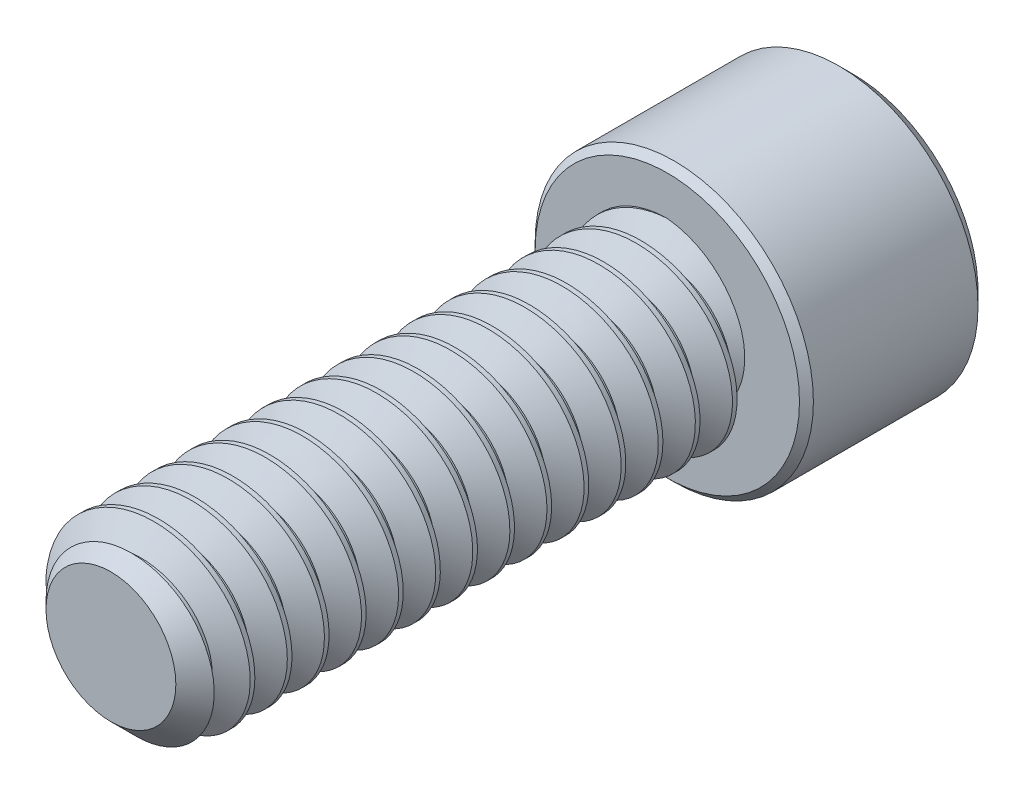
from build123d import *

# Parameters (mm, degrees)
SKETCH1_R          = 3.175
EXTRUDE1_DEPTH     = 19.05
CHAMFER3_SIZE      = 0.9525
CUT_SWEEP1_PITCH   = 1.27
SKETCH6_R          = 4.7625
EXTRUDE2_DEPTH     = 6.35
CUT_EXTRUDE1_DEPTH = 3.571875
CHAMFER1_SIZE      = 0.47625
CHAMFER2_SIZE      = 0.238125


with BuildPart() as part:
    # Sketch1 → Extrude1 (new body)
    with BuildSketch(Plane.XY):
        Circle(SKETCH1_R)
    extrude(amount=-EXTRUDE1_DEPTH)

    # Chamfer3
    chamfer3_edges = [part.edges().sort_by_distance(p)[0] for p in [
        (-3.175, 0, 0),
    ]]
    chamfer(chamfer3_edges, length=CHAMFER3_SIZE)

    # Cut-Sweep1: the profile of Sketch3 profile screwed along a right-hand helix of 16 turns, 6 arcs to a turn; built about Z, then put on its axis
    cut_sweep1_z = Axis((0, 0, 0), (0, 0, 1))
    cut_sweep1_corners = [(3.1753, 0, -1.111423205), (2.350110803, 0, -0.635), (2.350110803, 0, -0.47625), (3.1753, 0, 0.000173205)]
    with BuildLine(mode=Mode.PRIVATE) as cut_sweep1_profile:
        Line(cut_sweep1_corners[0], cut_sweep1_corners[1])
        Line(cut_sweep1_corners[1], cut_sweep1_corners[2])
        Line(cut_sweep1_corners[2], cut_sweep1_corners[3])
        Line(cut_sweep1_corners[3], cut_sweep1_corners[0])
    cut_sweep1_cap = Face(cut_sweep1_profile.wire())
    cut_sweep1_turn_angles = [0, 30, 60, 90, 120, 150, 180, 210, 240, 270, 300, 330, 360]
    cut_sweep1_turn_weights = [1, 0.8660254037844387, 1, 0.8660254037844387, 1, 0.8660254037844387, 1, 0.8660254037844387, 1, 0.8660254037844387, 1, 0.8660254037844387, 1]
    cut_sweep1_turn_rails = [Edge.make_bspline([Vector(p[0], p[1], 0).rotate(cut_sweep1_z, cut_sweep1_turn_angles[k]) / cut_sweep1_turn_weights[k] + Vector(0, 0, p[2] + CUT_SWEEP1_PITCH * cut_sweep1_turn_angles[k] / 360) for k in range(13)], [0, 0, 0, 1, 1, 2, 2, 3, 3, 4, 4, 5, 5, 6, 6, 6], 2, cut_sweep1_turn_weights) for p in cut_sweep1_corners]
    cut_sweep1_turn_sides = [Face.make_surface_from_curves(cut_sweep1_turn_rails[p[0]], cut_sweep1_turn_rails[p[1]]) for p in [(0, 1), (1, 2), (2, 3), (3, 0)]]
    cut_sweep1 = Plane(origin=(0, 0, 0), x_dir=(0, 1, 0), z_dir=(0, 0, -1)) * Solid(Shell([*[p.moved(Location((0, 0, CUT_SWEEP1_PITCH * i))) for i in range(16) for p in cut_sweep1_turn_sides], cut_sweep1_cap, cut_sweep1_cap.rotate(cut_sweep1_z, 5760).moved(Location((0, 0, CUT_SWEEP1_PITCH * 5760 / 360)))]))
    add(cut_sweep1, mode=Mode.SUBTRACT)

    # Sketch6 → Extrude2 (add)
    with BuildSketch(Plane(origin=(0, 0, -19.05), x_dir=(-1, 0, 0), z_dir=(0, 0, -1))):
        Circle(SKETCH6_R)
    extrude(amount=EXTRUDE2_DEPTH)

    # Sketch7 → Cut-Extrude1 (cut)
    with BuildSketch(Plane(origin=(0, 0, -25.4), x_dir=(-1, 0, 0), z_dir=(0, 0, -1))):
        Polygon((0, 2.749630657), (-2.38125, 1.374815329), (-2.38125, -1.374815329), (0, -2.749630657), (2.38125, -1.374815329), (2.38125, 1.374815329), align=None)
    extrude(amount=-CUT_EXTRUDE1_DEPTH, mode=Mode.SUBTRACT)

    # Cut-Extrude2 cone 1 section (through the dimple's axis) → Cut-Extrude2 (revolve, cut)
    with BuildSketch(Plane(origin=(0, 0, -25.4), x_dir=(0, 1, 0), z_dir=(1, 0, 0))):
        Polygon((0, 0), (2.749630657, 0), (0, 2.749630657), align=None)
    revolve(axis=Axis((0, 0, -25.4), (0, 0, 1)), mode=Mode.SUBTRACT)

    # Chamfer1
    chamfer1_edges = [part.edges().sort_by_distance(p)[0] for p in [
        (4.7625, 0, -25.4),
    ]]
    chamfer(chamfer1_edges, length=CHAMFER1_SIZE)

    # Chamfer2
    chamfer2_edges = [part.edges().sort_by_distance(p)[0] for p in [
        (4.7625, 0, -19.05),
    ]]
    chamfer(chamfer2_edges, length=CHAMFER2_SIZE)


solid = part.part
